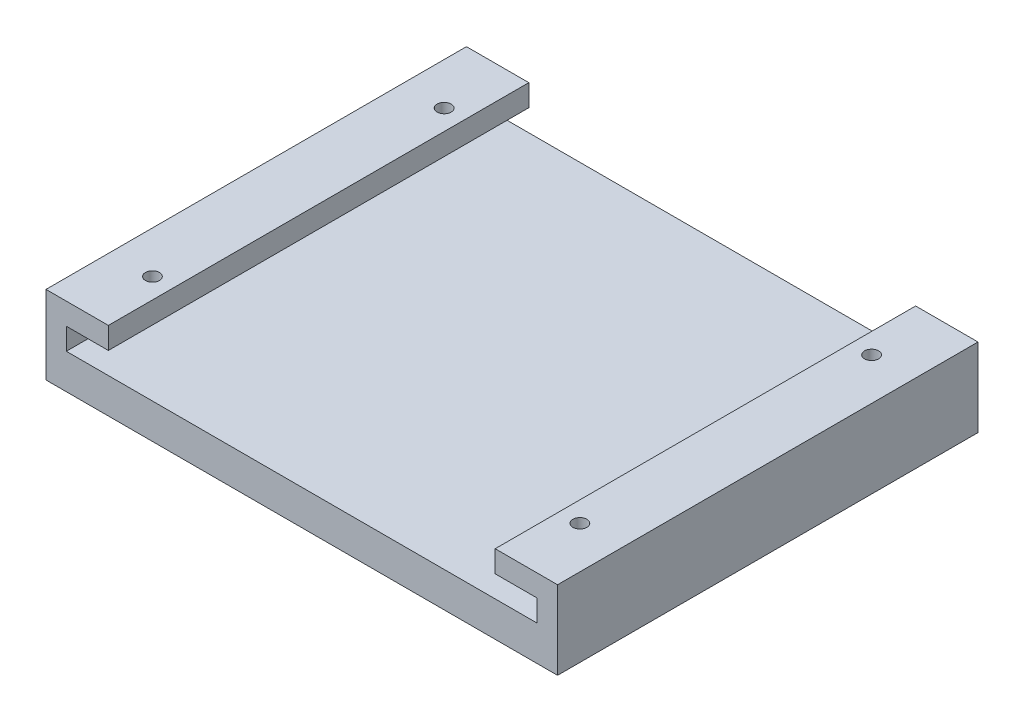
from build123d import *

# Parameters (mm, degrees)
SKETCH1_W           = 73
SKETCH1_H           = 60
BOSS_EXTRUDE1_DEPTH = 5
SKETCH2_W           = 2.9
SKETCH2_H           = 60
BOSS_EXTRUDE2_DEPTH = 6.2
SKETCH9_W           = 60
SKETCH9_H           = 3.1
BOSS_EXTRUDE3_DEPTH = 6
SKETCH10_W          = 60
SKETCH10_H          = 3.1
BOSS_EXTRUDE4_DEPTH = 6
SKETCH11_R          = 1
CUT_EXTRUDE3_DEPTH  = 3.5


with BuildPart() as part:
    # Sketch1 → Boss-Extrude1 (new body)
    with BuildSketch(Plane(origin=(0, 0, 0), x_dir=(1, 0, 0), z_dir=(0, 1, 0))):
        Rectangle(SKETCH1_W, SKETCH1_H)
    extrude(amount=BOSS_EXTRUDE1_DEPTH)

    # Sketch2 → Boss-Extrude2 (add)
    with BuildSketch(Plane(origin=(0, 5, 0), x_dir=(1, 0, 0), z_dir=(0, 1, 0))):
        with Locations((-35.05, 0)):
            Rectangle(SKETCH2_W, SKETCH2_H)
        with Locations((35.05, 0)):
            Rectangle(SKETCH2_W, SKETCH2_H)
    extrude(amount=BOSS_EXTRUDE2_DEPTH)

    # Sketch9 → Boss-Extrude3 (add)
    with BuildSketch(Plane(origin=(-33.6, 0, 0), x_dir=(0, 0, -1), z_dir=(1, 0, 0))):
        with Locations((0, 9.65)):
            Rectangle(SKETCH9_W, SKETCH9_H)
    extrude(amount=BOSS_EXTRUDE3_DEPTH)

    # Sketch10 → Boss-Extrude4 (add)
    with BuildSketch(Plane.ZY.offset(-33.6)):
        with Locations((0, 9.65)):
            Rectangle(SKETCH10_W, SKETCH10_H)
    extrude(amount=BOSS_EXTRUDE4_DEPTH)

    # Sketch11 → Cut-Extrude3 (cut)
    with BuildSketch(Plane(origin=(0, 11.2, 0), x_dir=(1, 0, 0), z_dir=(0, 1, 0))):
        with Locations((-30.5, 20.815)):
            Circle(SKETCH11_R)
        with Locations((-30.5, -20.815)):
            Circle(SKETCH11_R)
        with Locations((30.5, 20.815)):
            Circle(SKETCH11_R)
        with Locations((30.5, -20.815)):
            Circle(SKETCH11_R)
    extrude(amount=-CUT_EXTRUDE3_DEPTH, mode=Mode.SUBTRACT)


solid = part.part
